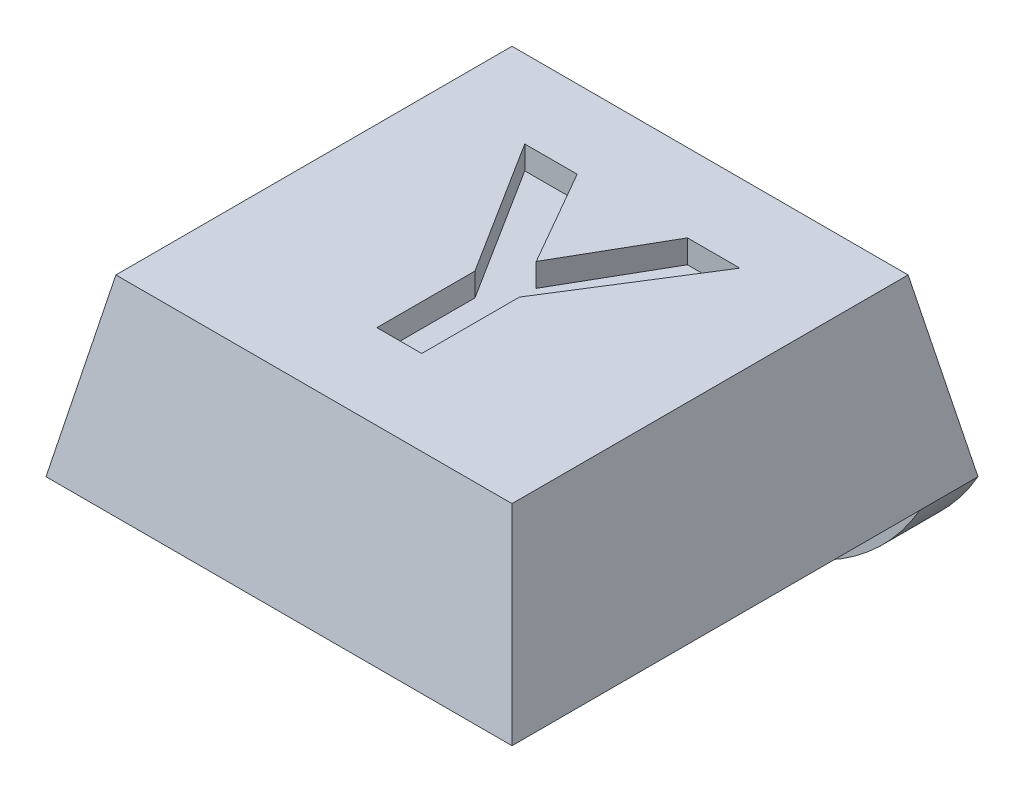
from build123d import *

# Parameters (mm, degrees)
SKETCH1_W               = 8
SKETCH1_H               = 8
BOSS_EXTRUDE1_DEPTH     = 3
CUT_EXTRUDE1_DEPTH      = 12.704699911
CUT_EXTRUDE1_DEPTH_BACK = 12.704699911
CUT_EXTRUDE2_DEPTH      = 11
SKETCH4_R               = 1.8
CUT_EXTRUDE3_DEPTH      = 0.8
SKETCH5_W               = 8
SKETCH5_H               = 1
BOSS_EXTRUDE2_DEPTH     = 2
FILLET1_R               = 4
CUT_EXTRUDE4_DEPTH      = 0.4


with BuildPart() as part:
    # Sketch1 → Boss-Extrude1 (new body)
    with BuildSketch(Plane(origin=(0, 0, 0), x_dir=(1, 0, 0), z_dir=(0, 1, 0))):
        with Locations((4, 4)):
            Rectangle(SKETCH1_W, SKETCH1_H)
    extrude(amount=BOSS_EXTRUDE1_DEPTH)

    # Sketch2 → Cut-Extrude1 (cut, two sides: drawn at the far end of the back side and taken through both)
    with BuildSketch(Plane.XY.offset(-CUT_EXTRUDE1_DEPTH_BACK)):
        Polygon((0, 0), (0.6, 3), (0, 3), align=None)
        Polygon((8, 0), (7.4, 3), (8, 3), align=None)
    extrude(amount=CUT_EXTRUDE1_DEPTH + CUT_EXTRUDE1_DEPTH_BACK, mode=Mode.SUBTRACT)

    # Sketch3 → Cut-Extrude2 (cut)
    with BuildSketch(Plane(origin=(0, 0, 0), x_dir=(0, 0, -1), z_dir=(1, 0, 0))):
        Polygon((0, 0), (0.6, 3), (0, 3), align=None)
        Polygon((8, 3), (7.4, 3), (8, 0), align=None)
    extrude(amount=CUT_EXTRUDE2_DEPTH, mode=Mode.SUBTRACT)

    # Sketch4 → Cut-Extrude3 (cut)
    with BuildSketch(Plane.XZ):
        with Locations(Location((4, -3.75, 0), (0, 0, 270))):
            Circle(SKETCH4_R)
    extrude(amount=-CUT_EXTRUDE3_DEPTH, mode=Mode.SUBTRACT)

    # Sketch5 → Boss-Extrude2 (add)
    with BuildSketch(Plane.XZ):
        with Locations((4, -7.5)):
            Rectangle(SKETCH5_W, SKETCH5_H)
    extrude(amount=BOSS_EXTRUDE2_DEPTH)

    # Fillet1
    # the kernel refuses this fillet: 4 mm, written as the material it takes off along each edge
    with BuildSketch(Plane(origin=(8, -2, -16.660254038), x_dir=(0, 1, 0), z_dir=(0, 0, 1)), Plane(origin=(0, -2, 1.660254038), x_dir=(0, 1, 0), z_dir=(0, 0, -1))) as fillet1_piece_1:
        with BuildLine():
            CenterArc((4, 3.464101615), FILLET1_R, 180, 60)
            Line((0, 3.464101615), (-0.08, 3.464101615))
            Line((-0.08, 3.464101615), (-0.08, 0))
            Line((-0.08, 0), (0, -0.08))
            ThreePointArc((0, -0.08), (1, -0.08), (1.96, -0.069282032))
            Line((1.96, -0.069282032), (2, 0))
        make_face()
    extrude(amount=18.320508076, mode=Mode.SUBTRACT)

    # Sketch6 → Cut-Extrude4 (cut)
    with BuildSketch(Plane(origin=(0, 3, 0), x_dir=(1, 0, 0), z_dir=(0, 1, 0))):
        Polygon((3.623842243, 2.056832464), (3.623842243, 3.740326053), (2.162303782, 6.056832464), (3.062143525, 6.056832464), (4.007656346, 4.408595284), (4.95477173, 6.056832464), (5.854611474, 6.056832464), (4.393073013, 3.734717079), (4.393073013, 2.056832464), align=None)
    extrude(amount=-CUT_EXTRUDE4_DEPTH, mode=Mode.SUBTRACT)


solid = part.part
